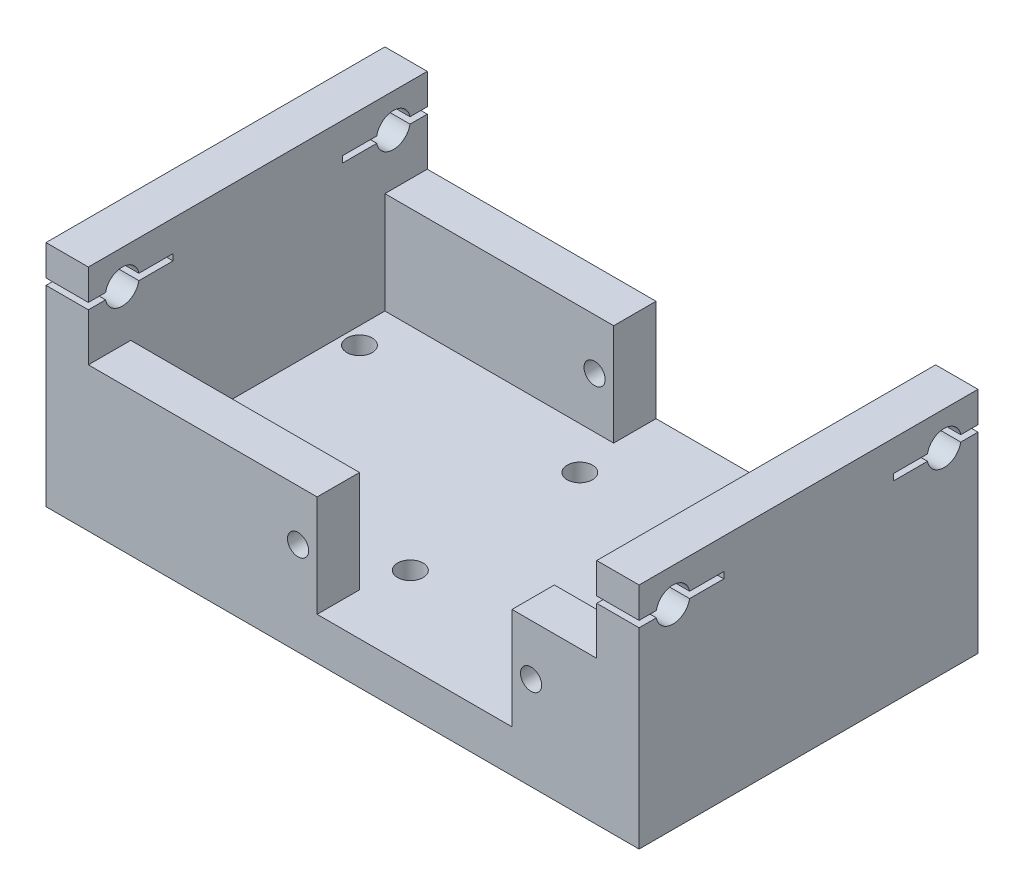
from build123d import *

# Parameters (mm, degrees)
SKETCH1_W               = 70
SKETCH1_H               = 40
BOSS_EXTRUDE1_DEPTH     = 5
BOSS_EXTRUDE2_DEPTH     = 12
SKETCH3_W               = 5
SKETCH3_H               = 40
BOSS_EXTRUDE3_DEPTH     = 10
SKETCH5_R               = 2
CUT_EXTRUDE1_DEPTH      = 78.646635471
CUT_EXTRUDE3_DEPTH      = 57.382621436
CUT_EXTRUDE3_DEPTH_BACK = 57.382621436
SKETCH7_R               = 1.25
SKETCH8_W               = 10
SKETCH8_H               = 0.75
CUT_EXTRUDE4_DEPTH      = 78.646635471
SKETCH12_R              = 1.5
CUT_EXTRUDE6_DEPTH      = 49.518037883


with BuildPart() as part:
    # Sketch1 → Boss-Extrude1 (new body)
    with BuildSketch(Plane(origin=(0, 0, 0), x_dir=(1, 0, 0), z_dir=(0, 1, 0))):
        Rectangle(SKETCH1_W, SKETCH1_H)
    extrude(amount=BOSS_EXTRUDE1_DEPTH)

    # Sketch2 → Boss-Extrude2 (add)
    with BuildSketch(Plane(origin=(0, 5, 0), x_dir=(1, 0, 0), z_dir=(0, 1, 0))):
        Polygon((-3, -20), (-3, -15), (-30, -15), (-30, 15), (-3, 15), (-3, 20), (-35, 20), (-35, -20), align=None)
        Polygon((20, -15), (30, -15), (30, 15), (20, 15), (20, 20), (35, 20), (35, -20), (20, -20), align=None)
    extrude(amount=BOSS_EXTRUDE2_DEPTH)

    # Sketch3 → Boss-Extrude3 (add)
    with BuildSketch(Plane(origin=(0, 17, 0), x_dir=(1, 0, 0), z_dir=(0, 1, 0))):
        with Locations((32.5, 0)):
            Rectangle(SKETCH3_W, SKETCH3_H)
        with Locations((-32.5, 0)):
            Rectangle(SKETCH3_W, SKETCH3_H)
    extrude(amount=BOSS_EXTRUDE3_DEPTH)

    # Sketch5 → Cut-Extrude1 (cut, through all)
    with BuildSketch(Plane.ZY.offset(35)):
        with Locations((16, 23)):
            Circle(SKETCH5_R)
        with Locations((-16, 23)):
            Circle(SKETCH5_R)
    extrude(amount=-CUT_EXTRUDE1_DEPTH, mode=Mode.SUBTRACT)

    # Sketch7 → Cut-Extrude3 (cut, two sides: drawn at the far end of the back side and taken through both)
    with BuildSketch(Plane(origin=(0, 0, 15), x_dir=(-1, 0, 0), z_dir=(0, 0, -1)).offset(-CUT_EXTRUDE3_DEPTH_BACK)):
        with Locations((-22.25, 11)):
            Circle(SKETCH7_R)
        with Locations((5.25, 11)):
            Circle(SKETCH7_R)
    extrude(amount=CUT_EXTRUDE3_DEPTH + CUT_EXTRUDE3_DEPTH_BACK, mode=Mode.SUBTRACT)

    # Sketch8 → Cut-Extrude4 (cut, through all)
    with BuildSketch(Plane.ZY.offset(35)):
        with Locations((15, 23)):
            Rectangle(SKETCH8_W, SKETCH8_H)
        with Locations((-15, 23)):
            Rectangle(SKETCH8_W, SKETCH8_H)
    extrude(amount=-CUT_EXTRUDE4_DEPTH, mode=Mode.SUBTRACT)

    # Sketch12 → Cut-Extrude6 (cut, through all)
    with BuildSketch(Plane.XZ):
        with Locations((-28, 10)):
            Circle(SKETCH12_R)
        with Locations((-28, -10)):
            Circle(SKETCH12_R)
        with Locations((-2, 10)):
            Circle(SKETCH12_R)
        with Locations((-2, -10)):
            Circle(SKETCH12_R)
    extrude(amount=-CUT_EXTRUDE6_DEPTH, mode=Mode.SUBTRACT)


solid = part.part
